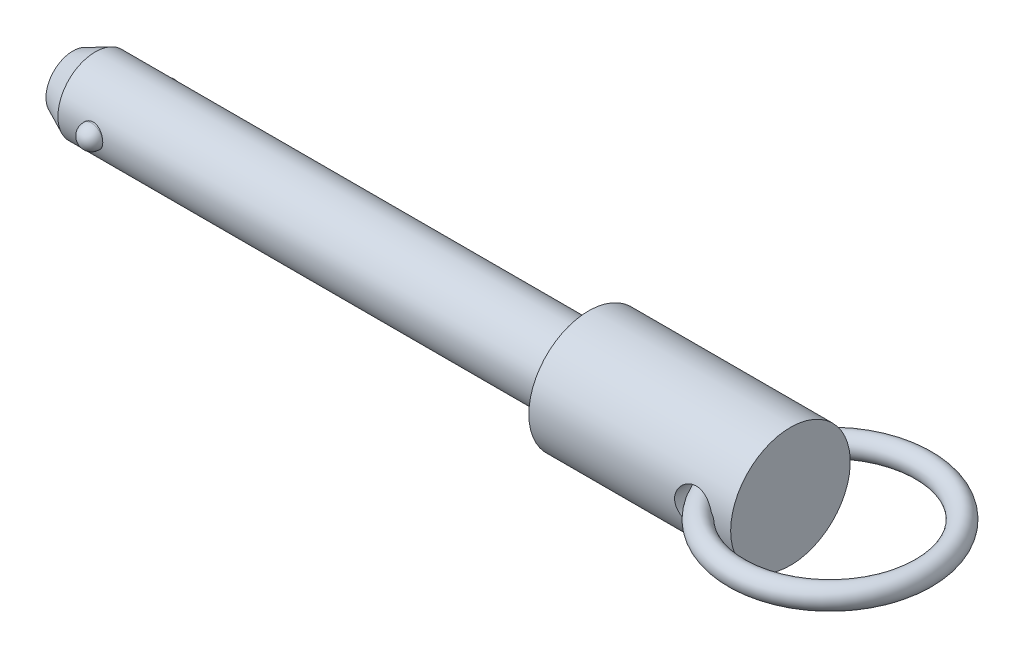
from build123d import *
from build123d.topology import SkipClean

# Parameters (mm, degrees)
CHAMFER1_SIZE           = 3
CHAMFER1_SIZE2          = 1.398922974
SKETCH2_W               = 1.5
SKETCH2_H               = 13
FILLET1_R               = 1.5
CUT_EXTRUDE1_DEPTH      = 88.732548122
CUT_EXTRUDE1_DEPTH_BACK = 88.732548122
SKETCH3_R               = 2.5
SKETCH5_R               = 1.5


with BuildPart() as part:
    # Sketch1 → Revolve1 (revolve)
    with BuildSketch(Plane(origin=(0, 0, 0), x_dir=(1, 0, 0), z_dir=(0, 1, 0)), mode=Mode.PRIVATE) as revolve1_sk:
        Polygon((0, 5), (-9, 5), (-9, 0), (87, 0), (87, 8), (60, 8), (60, 5), align=None)
    revolve(revolve1_sk.sketch.rotate(Axis((0, 0, 0), (1, 0, 0)), 180), axis=Axis((0, 0, 0), (1, 0, 0)))

    # Chamfer1
    chamfer1_edges = [part.edges().sort_by_distance(p)[0] for p in [
        (-9, 0, -5),
    ]]
    chamfer1_side = [part.faces().sort_by_distance(p)[0] for p in [
        (25.5, 0, -5),
    ]]
    chamfer(chamfer1_edges, length=CHAMFER1_SIZE, length2=CHAMFER1_SIZE2, reference=chamfer1_side[0])

    # Sketch2 → Revolve2 (revolve)
    with BuildSketch(Plane(origin=(0, 0, 0), x_dir=(1, 0, 0), z_dir=(0, 1, 0))):
        with Locations((-0.75, 0)):
            Rectangle(SKETCH2_W, SKETCH2_H)
    revolve(axis=Axis((-1.5, 0, -7.755836722), (0, 0, -1)))

    # Fillet1
    fillet1_edges = [part.edges().sort_by_distance(p)[0] for p in [
        (-3, 0, -6.5),
        (-3, 0, 6.5),
    ]]
    fillet(fillet1_edges, radius=FILLET1_R - 0.0001)  # a hair under: the kernel refuses the full size

    # Sketch3 → Cut-Extrude1 (cut, two sides: drawn at the far end of the back side and taken through both)
    with BuildSketch(Plane.XY.offset(-CUT_EXTRUDE1_DEPTH_BACK)):
        with Locations((82, 0)):
            Circle(SKETCH3_R)
    extrude(amount=CUT_EXTRUDE1_DEPTH + CUT_EXTRUDE1_DEPTH_BACK, mode=Mode.SUBTRACT)

    # Sketch5 → Revolve3 (revolve)
    with SkipClean():  # the faces are left unmerged after this step: merging them gives an invalid solid
        with BuildSketch(Plane.XY, mode=Mode.PRIVATE) as revolve3_sk:
            with Locations((79.793803516, 0)):
                Circle(SKETCH5_R)
        revolve(revolve3_sk.sketch.rotate(Axis((92.293803516, 0, 0), (0, 1, 0)), 158.32912017), axis=Axis((92.293803516, 0, 0), (0, 1, 0)))


solid = part.part
